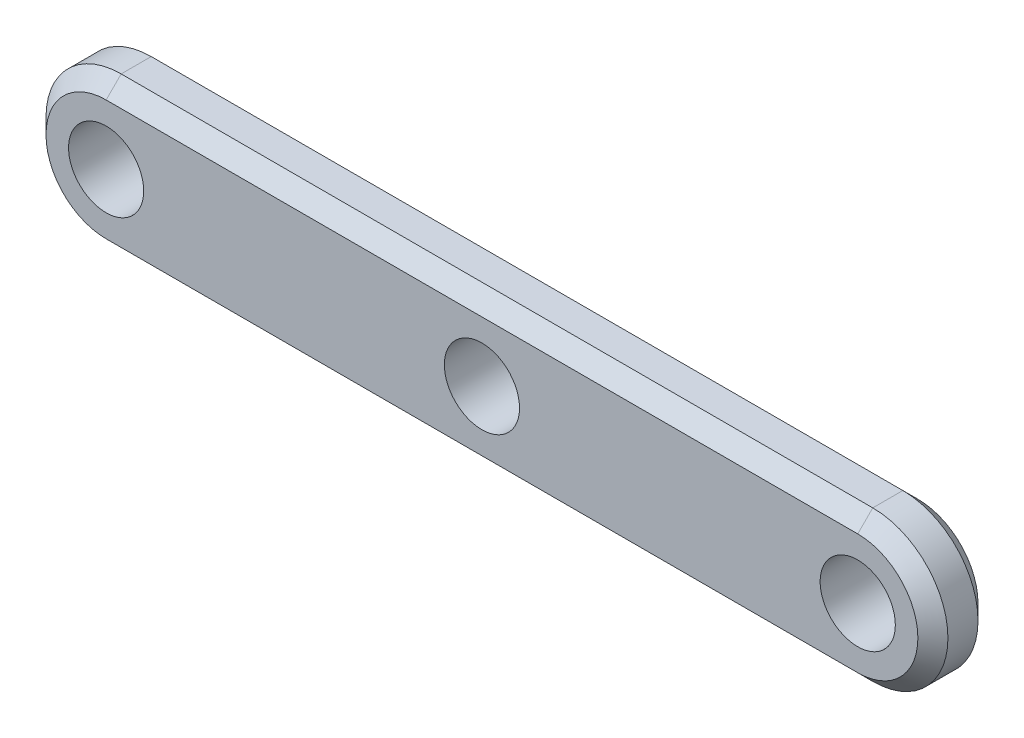
from build123d import *

# Parameters (mm, degrees)
SKETCH1_R           = 2.5
BOSS_EXTRUDE1_DEPTH = 4
CHAMFER1_SIZE       = 1


with BuildPart() as part:
    # Sketch1 → Boss-Extrude1 (new body)
    with BuildSketch(Plane.XY):
        with BuildLine():
            Line((50, 5), (0, 5))
            ThreePointArc((0, 5), (-5, 0), (0, -5))
            Line((0, -5), (50, -5))
            ThreePointArc((50, -5), (55, 0), (50, 5))
        make_face()
        with Locations((25, 0)):
            Circle(SKETCH1_R, mode=Mode.SUBTRACT)
        with Locations((50, 0)):
            Circle(SKETCH1_R, mode=Mode.SUBTRACT)
        Circle(SKETCH1_R, mode=Mode.SUBTRACT)
    extrude(amount=BOSS_EXTRUDE1_DEPTH)

    # Chamfer1
    chamfer1_edges = [part.edges().sort_by_distance(p)[0] for p in [
        (25, -5, 0),
        (-5, 0, 0),
        (55, 0, 0),
        (25, 5, 0),
        (25, -5, 4),
        (-5, 0, 4),
        (55, 0, 4),
        (25, 5, 4),
    ]]
    chamfer(chamfer1_edges, length=CHAMFER1_SIZE)


solid = part.part
